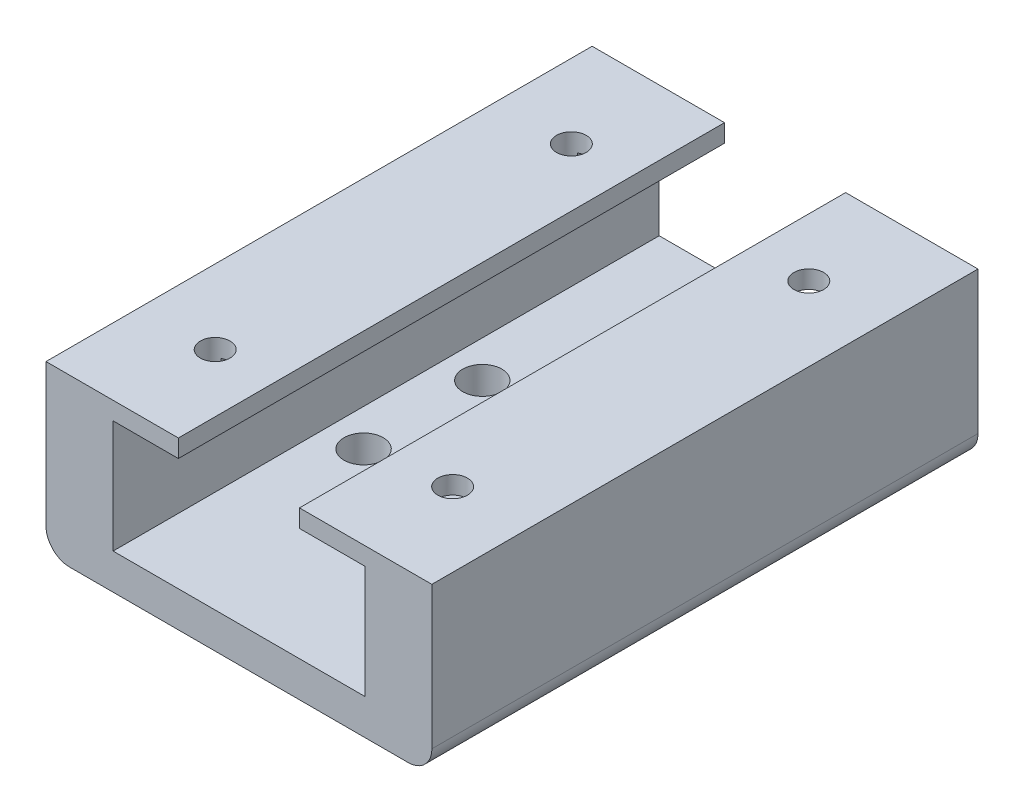
from build123d import *

# Parameters (mm, degrees)
SKETCH_1_W          = 32.5
SKETCH_1_H          = 46
EXTRUDE_1_DEPTH     = 14
CUT_EXTRUDE_2_DEPTH = 51.754925869
CUT_EXTRUDE_3_REACH = 33.449
SKETCH_4_R          = 1.65
SKETCH_5_R          = 1.25
CUT_EXTRUDE_4_DEPTH = 2
FILLET_1_R          = 2


with BuildPart() as part:
    # 草图1 → 凸台-拉伸1 (new body)
    with BuildSketch(Plane(origin=(0, 0, 0), x_dir=(1, 0, 0), z_dir=(0, 1, 0))):
        Rectangle(SKETCH_1_W, SKETCH_1_H)
    extrude(amount=EXTRUDE_1_DEPTH)

    # 草图2 → 切除-拉伸2 (cut, through all)
    with BuildSketch(Plane(origin=(0, 0, -23), x_dir=(-1, 0, 0), z_dir=(0, 0, -1))):
        Polygon((-5.1, 14), (-5.1, 12.5), (-10.6, 12.5), (-10.6, 3), (10.6, 3), (10.6, 12.5), (5.1, 12.5), (5.1, 14), align=None)
    extrude(amount=-CUT_EXTRUDE_2_DEPTH, mode=Mode.SUBTRACT)

    # 草图4 → 切除-拉伸3 (cut, up to next)
    with BuildSketch(Plane.XZ, mode=Mode.PRIVATE) as cut_extrude_3_sk1:
        with Locations((-7.5, 5)):
            Circle(SKETCH_4_R)
    cut_extrude_3_tool1 = extrude(cut_extrude_3_sk1.sketch, amount=-CUT_EXTRUDE_3_REACH, mode=Mode.PRIVATE) & part.part
    # 草图4 → 切除-拉伸3 (cut, up to next)
    with BuildSketch(Plane.XZ, mode=Mode.PRIVATE) as cut_extrude_3_sk2:
        with Locations((7.5, 5)):
            Circle(SKETCH_4_R)
    cut_extrude_3_tool2 = extrude(cut_extrude_3_sk2.sketch, amount=-CUT_EXTRUDE_3_REACH, mode=Mode.PRIVATE) & part.part
    # 草图4 → 切除-拉伸3 (cut, up to next)
    with BuildSketch(Plane.XZ, mode=Mode.PRIVATE) as cut_extrude_3_sk3:
        with Locations((7.5, -5)):
            Circle(SKETCH_4_R)
    cut_extrude_3_tool3 = extrude(cut_extrude_3_sk3.sketch, amount=-CUT_EXTRUDE_3_REACH, mode=Mode.PRIVATE) & part.part
    # 草图4 → 切除-拉伸3 (cut, up to next)
    with BuildSketch(Plane.XZ, mode=Mode.PRIVATE) as cut_extrude_3_sk4:
        with Locations((-7.5, -5)):
            Circle(SKETCH_4_R)
    cut_extrude_3_tool4 = extrude(cut_extrude_3_sk4.sketch, amount=-CUT_EXTRUDE_3_REACH, mode=Mode.PRIVATE) & part.part
    add(cut_extrude_3_tool1.solids().sort_by_distance((-7.5, 0, 5))[0], mode=Mode.SUBTRACT)
    add(cut_extrude_3_tool2.solids().sort_by_distance((7.5, 0, 5))[0], mode=Mode.SUBTRACT)
    add(cut_extrude_3_tool3.solids().sort_by_distance((7.5, 0, -5))[0], mode=Mode.SUBTRACT)
    add(cut_extrude_3_tool4.solids().sort_by_distance((-7.5, 0, -5))[0], mode=Mode.SUBTRACT)

    # 草图5 → 切除-拉伸4 (cut)
    with BuildSketch(Plane(origin=(0, 14, 0), x_dir=(1, 0, 0), z_dir=(0, 1, 0))):
        with Locations((-10, 15)):
            Circle(SKETCH_5_R)
        with Locations((10, 15)):
            Circle(SKETCH_5_R)
        with Locations((10, -15)):
            Circle(SKETCH_5_R)
        with Locations((-10, -15)):
            Circle(SKETCH_5_R)
    extrude(amount=-CUT_EXTRUDE_4_DEPTH, mode=Mode.SUBTRACT)

    # 圆角1
    fillet_1_edges = [part.edges().sort_by_distance(p)[0] for p in [
        (16.25, 0, 0),
        (-16.25, 0, 0),
    ]]
    fillet(fillet_1_edges, radius=FILLET_1_R)


solid = part.part
